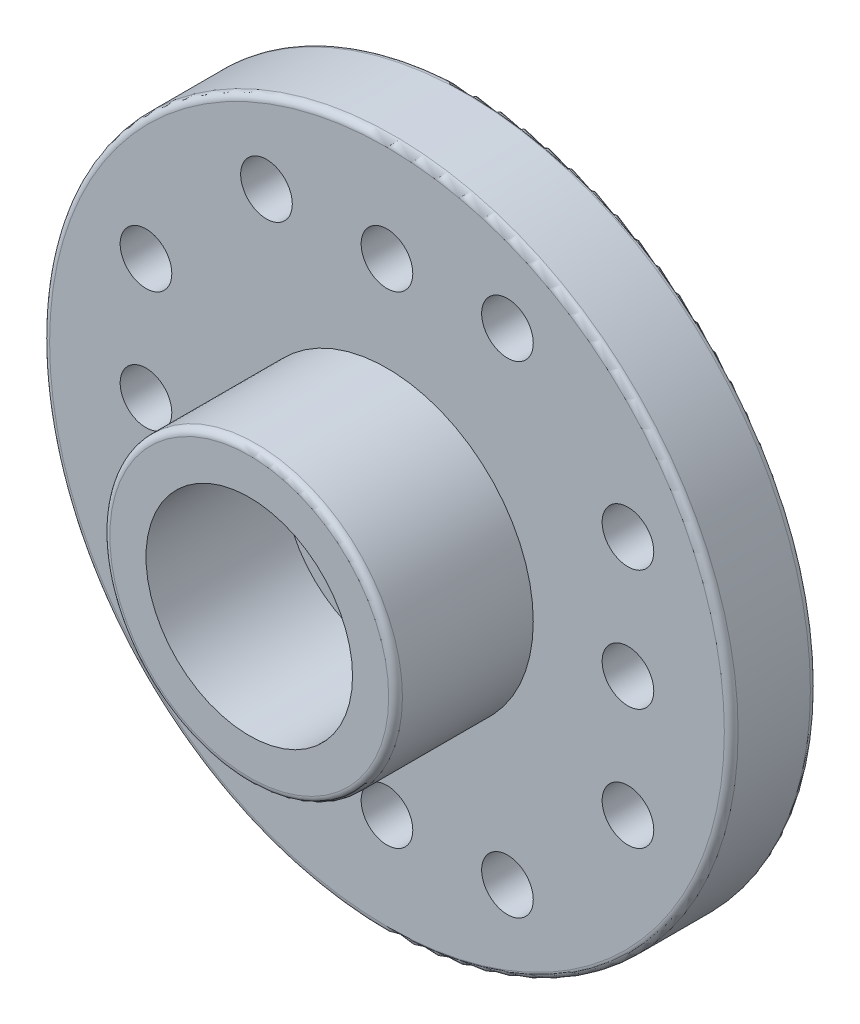
from build123d import *

# Parameters (mm, degrees)
SKETCH1_R           = 10
SKETCH1_R_2         = 0.75
SKETCH1_R_3         = 1.5
BOSS_EXTRUDE1_DEPTH = 2.5
SKETCH5_R           = 4.25
SKETCH5_R_2         = 3
BOSS_EXTRUDE2_DEPTH = 4
SKETCH6_R           = 4.5
CUT_EXTRUDE1_DEPTH  = 0.8
SKETCH7_R           = 3.7
SKETCH7_R_2         = 3.5
BOSS_EXTRUDE3_DEPTH = 1
FILLET1_R           = 0.2


with BuildPart() as part:
    # Sketch1 → Boss-Extrude1 (new body)
    with BuildSketch(Plane.XY):
        Circle(SKETCH1_R)
        with Locations((-7, 0)):
            Circle(SKETCH1_R_2, mode=Mode.SUBTRACT)
        with Locations((3.5, 7)):
            Circle(SKETCH1_R_2, mode=Mode.SUBTRACT)
        with Locations((0, 7)):
            Circle(SKETCH1_R_2, mode=Mode.SUBTRACT)
        with Locations((-3.5, 7)):
            Circle(SKETCH1_R_2, mode=Mode.SUBTRACT)
        with Locations((7, -3.5)):
            Circle(SKETCH1_R_2, mode=Mode.SUBTRACT)
        with Locations((7, 0)):
            Circle(SKETCH1_R_2, mode=Mode.SUBTRACT)
        with Locations((7, 3.5)):
            Circle(SKETCH1_R_2, mode=Mode.SUBTRACT)
        with Locations((-3.5, -7)):
            Circle(SKETCH1_R_2, mode=Mode.SUBTRACT)
        with Locations((0, -7)):
            Circle(SKETCH1_R_2, mode=Mode.SUBTRACT)
        with Locations((3.5, -7)):
            Circle(SKETCH1_R_2, mode=Mode.SUBTRACT)
        with Locations((-7, -3.5)):
            Circle(SKETCH1_R_2, mode=Mode.SUBTRACT)
        with Locations((-7, 3.5)):
            Circle(SKETCH1_R_2, mode=Mode.SUBTRACT)
        Circle(SKETCH1_R_3, mode=Mode.SUBTRACT)
    extrude(amount=BOSS_EXTRUDE1_DEPTH)

    # Sketch5 → Boss-Extrude2 (add)
    with BuildSketch(Plane.XY.offset(2.5)):
        Circle(SKETCH5_R)
        Circle(SKETCH5_R_2, mode=Mode.SUBTRACT)
    extrude(amount=BOSS_EXTRUDE2_DEPTH)

    # Sketch6 → Cut-Extrude1 (cut)
    with BuildSketch(Plane(origin=(0, 0, 0), x_dir=(-1, 0, 0), z_dir=(0, 0, -1))):
        Circle(SKETCH6_R)
    extrude(amount=-CUT_EXTRUDE1_DEPTH, mode=Mode.SUBTRACT)

    # Sketch7 → Boss-Extrude3 (add)
    with BuildSketch(Plane(origin=(0, 0, 0.8), x_dir=(-1, 0, 0), z_dir=(0, 0, -1))):
        with Locations((0.162730827, 0)):
            Circle(SKETCH7_R)
        with Locations((0.162730827, 0)):
            Circle(SKETCH7_R_2, mode=Mode.SUBTRACT)
    extrude(amount=BOSS_EXTRUDE3_DEPTH)

    # Fillet1
    fillet1_edges = [part.edges().sort_by_distance(p)[0] for p in [
        (-10, 0, 0),
        (-10, 0, 2.5),
        (4.5, 0, 0),
        (-4.25, 0, 6.5),
    ]]
    fillet(fillet1_edges, radius=FILLET1_R)


solid = part.part
